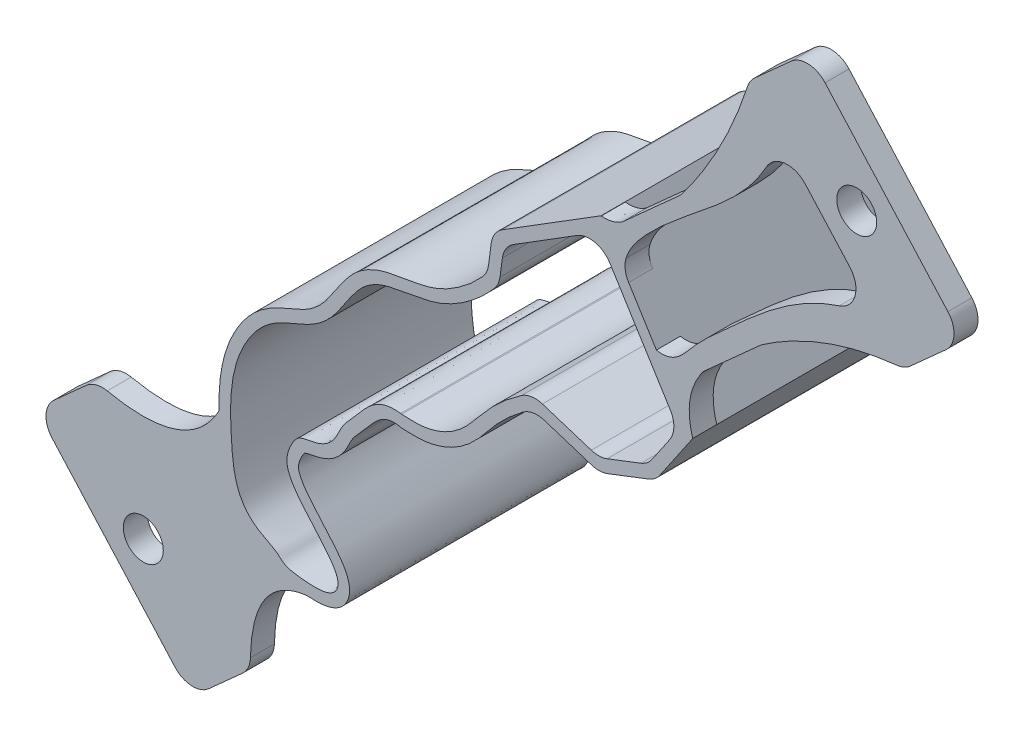
from build123d import *

# Parameters (mm, degrees)
AUFSATZ_LINEAR_AUSTRAGEN1_DEPTH     = 30
AUFSATZ_LINEAR_START                = -3
AUFSATZ_LINEAR_AUSTRAGEN2_OUTLINE_R = 2.5
AUFSATZ_LINEAR_AUSTRAGEN2_DEPTH     = 3
VERRUNDUNG3_R                       = 3
VERRUNDUNG4_R                       = 3
VERRUNDUNG5_R                       = 3


with BuildPart() as part:
    # Skizze1 → Aufsatz-Linear austragen1 (new body)
    with BuildSketch(Plane.XY):
        with BuildLine():
            Line((40.712795696, 109.980558381), (41.357196523, 114.844095725))
            Line((41.357196523, 114.844095725), (54.9236108, 123.298967756))
            Line((54.9236108, 123.298967756), (66.390293439, 104.899899561))
            Line((66.390293439, 104.899899561), (61.744811743, 98.070839034))
            Line((61.744811743, 98.070839034), (54.740060962, 95.368898907))
            Line((54.740060962, 95.368898907), (46.430160156, 98.015797727))
            add(Edge.make_bspline(
                [(46.430160156, 98.015797727), (46.133118112, 97.821539469), (45.560194818, 97.435582063), (44.323214705, 96.52582267), (43.021043899, 95.418325919), (41.744902268, 94.077457141), (40.736662715, 92.859306382), (39.581081755, 91.433941103), (37.778639533, 89.690678695), (35.451956815, 88.348509895), (33.277875943, 87.844682389), (31.822691433, 87.748576032), (30.914882413, 87.763513011), (30.334792, 87.799233053), (30.071333911, 87.812696327), (30.000726266, 87.815038818), (29.939219568, 87.815295899), (29.911740929, 87.815436571)],
                knots=[0.076021596, 0.076021596, 0.076021596, 0.076021596, 0.09538587, 0.114750145, 0.153478693, 0.172842968, 0.192207242, 0.211571516, 0.23093579, 0.269664339, 0.308392887, 0.327757162, 0.347121436, 0.36648571, 0.376167847, 0.381008916, 0.385849984, 0.385849984, 0.385849984, 0.385849984], degree=3))
            Line((29.911740929, 87.815436571), (29.62239267, 87.889670136))
            add(Edge.make_bspline(
                [(40.712795696, 109.980558381), (40.548290105, 109.789990703), (40.039182766, 109.20798272), (39.167861043, 108.296145835), (37.904291205, 107.200078175), (36.515705172, 106.210004839), (35.045545467, 105.391631852), (33.626198045, 104.836349806), (32.054424536, 104.471806717), (30.333212831, 104.194102855), (28.520443777, 103.881275993), (26.631534522, 103.380598721), (24.686505418, 102.296150918), (23.309902097, 100.900500285), (21.9193236, 99.007131286), (20.866202835, 97.283935928), (19.779585209, 96.02734761), (18.843140816, 95.203796027), (17.884364082, 94.594752536), (16.598126478, 94.019608823), (15.023524875, 93.372404681), (13.272103108, 92.514133576), (11.453160876, 91.141228317), (10.021987048, 89.435023934), (8.896885582, 87.567002022), (7.78796415, 84.963327749), (7.122132616, 81.701156546), (7.071348113, 78.520848037), (7.199844736, 76.033432144), (7.323660979, 74.135825703), (7.609070129, 72.026837516), (8.292311289, 69.828834885), (9.438444136, 68.044525364), (10.846814268, 66.847818704), (11.860138531, 66.229023741), (12.747914579, 65.759124634), (13.31528287, 65.457503), (13.515237066, 65.315512768), (13.619103725, 65.232515949), (13.79443678, 65.064182205), (14.29111038, 64.633469416), (15.063218315, 64.226663608), (15.815143452, 64.012618452), (16.597545646, 63.876744695), (17.543475142, 63.76618048), (18.628786313, 63.685945228), (19.57974188, 63.694314785), (20.339163549, 63.762013846), (21.039258726, 63.909981585), (21.685275417, 64.167377768), (22.22136524, 64.482950297), (22.782264662, 64.990062879), (23.260590116, 65.760615934), (23.465211305, 66.62565005), (23.444773621, 67.337049868), (23.3241199, 67.912818377), (23.099695556, 68.547400118), (22.759727338, 69.193862767), (22.295741745, 69.894788562), (21.609475819, 70.799600306), (20.64968698, 71.925960664), (19.462804526, 73.260962624), (18.397347107, 74.503600358), (17.434728056, 75.816893869), (17.097216233, 76.650632456), (17.042572198, 77.103401149), (17.064956934, 77.419740639), (17.178589311, 77.850656011), (17.44570662, 78.473394429), (17.692068021, 78.875336912), (17.831149565, 79.035471349), (17.838343484, 79.036180261), (17.846443889, 79.05344298), (18.164589497, 79.156698605), (18.833630416, 79.274875887), (19.815927828, 79.475390957), (21.073139477, 79.96465406), (22.127912101, 80.793652418), (22.820091659, 81.695228191), (23.212038583, 82.400157107), (23.472755456, 82.945270551), (23.693757496, 83.380460628), (23.907052728, 83.717350053), (24.070879516, 83.926143053), (24.358884063, 84.237035133), (24.879871052, 84.825361069), (25.4181521, 85.476659504), (26.039852268, 86.210458902), (26.621551426, 86.827104219), (27.174014236, 87.306073269), (27.693548249, 87.63638678), (28.20218211, 87.84181382), (28.695408527, 87.929853815), (29.176693256, 87.937336678), (29.479804187, 87.909589639), (29.62239267, 87.889670136)],
                knots=[0.118634606, 0.118634606, 0.118634606, 0.118634606, 0.125304784, 0.139411674, 0.153518565, 0.167625455, 0.181732345, 0.195839236, 0.209946126, 0.224053016, 0.238159906, 0.252266797, 0.266373687, 0.280480577, 0.294587468, 0.322801248, 0.336908138, 0.351015029, 0.365121919, 0.379228809, 0.3933357, 0.40744259, 0.42154948, 0.435656371, 0.449763261, 0.463870151, 0.492083932, 0.520297712, 0.534404603, 0.548511493, 0.562618383, 0.576725273, 0.590832164, 0.597885609, 0.604939054, 0.611992499, 0.619045944, 0.626099389, 0.633152835, 0.64020628, 0.647259725, 0.65431317, 0.661366615, 0.66842006, 0.675473505, 0.682526951, 0.686053673, 0.689580396, 0.693107118, 0.69487048, 0.696633841, 0.698397202, 0.700160563, 0.701923925, 0.703687286, 0.705450647, 0.707214009, 0.710740731, 0.714267454, 0.717794176, 0.724847621, 0.731901067, 0.738954512, 0.746007957, 0.760114847, 0.767168292, 0.774221737, 0.781275183, 0.788328628, 0.795382073, 0.798908795, 0.802435518, 0.809488963, 0.816542408, 0.823595853, 0.830649299, 0.837702744, 0.844756189, 0.848282911, 0.851809634, 0.855336357, 0.858863079, 0.865916524, 0.872969969, 0.880023415, 0.88707686, 0.90118375, 0.91529064, 0.929397531, 0.943504421, 0.957611311, 0.971718201, 0.985825092, 0.992878537, 0.999931982, 0.999931982, 0.999931982, 0.999931982], degree=3))
        make_face()
        with BuildLine():
            Line((29.969568489, 89.315160187), (29.823008434, 89.32572491))
            add(Edge.make_bspline(
                [(29.823008434, 89.32572491), (29.634049207, 89.352122371), (29.239945437, 89.388313818), (28.556460135, 89.379725598), (27.800449797, 89.247010781), (27.012740349, 88.926589837), (26.288278433, 88.46044542), (25.604735463, 87.863939706), (24.949071146, 87.166756868), (24.302692789, 86.402531931), (23.765166835, 85.754158788), (23.296875597, 85.223980047), (22.984762685, 84.889259428), (22.709319238, 84.541368159), (22.427389129, 84.090337415), (22.163192754, 83.567764032), (21.915534142, 83.051499081), (21.601072096, 82.489181169), (21.092456284, 81.830373759), (20.347548142, 81.244177346), (19.422079602, 80.878195214), (18.589754696, 80.703614231), (17.883373743, 80.58093453), (17.330462963, 80.421161029), (16.94451163, 80.212863307), (16.560615727, 79.81069567), (16.143377483, 79.119835447), (15.817093326, 78.360073541), (15.630953758, 77.691932102), (15.580450829, 77.061735956), (15.699777384, 76.176400696), (16.191775108, 75.05526682), (17.275142932, 73.583534846), (18.375150692, 72.302199085), (19.560410501, 70.968886768), (20.486914416, 69.88053956), (21.115302704, 69.050966829), (21.514464193, 68.447177632), (21.824728354, 67.84714316), (21.99285266, 67.299990873), (22.006497445, 66.774045467), (21.900863922, 66.32933119), (21.65833539, 65.935114544), (21.257999222, 65.569862139), (20.739478688, 65.334322114), (20.134344256, 65.200542613), (19.517686804, 65.144571694), (18.691600923, 65.136182948), (17.688996134, 65.209097228), (16.790042598, 65.314573906), (16.125545308, 65.431586086), (15.587937169, 65.589583409), (15.118082163, 65.838511811), (14.795684432, 66.114619963), (14.527280266, 66.36691151), (14.179272352, 66.665834154), (12.875267469, 67.308541253), (11.683031042, 68.03919866), (10.565148073, 68.992869254), (9.630705263, 70.431029017), (9.035705286, 72.320526298), (8.769544386, 74.255257244), (8.647167845, 76.121130102), (8.521724902, 78.550590281), (8.574758706, 81.562367998), (9.306077931, 85.133968069), (10.785287491, 88.088838491), (12.473114823, 90.093876489), (14.524437951, 91.63909992), (16.674202511, 92.46498621), (18.538328804, 93.294841852), (20.126542097, 94.298729135), (21.811069814, 96.030633171), (23.14957242, 98.237535094), (24.42462416, 99.965924623), (25.594243304, 101.139863882), (27.138453327, 102.004845134), (28.808821724, 102.459873297), (30.547468534, 102.759813278), (32.310815277, 103.044008627), (34.0344587, 103.439326146), (36.225850312, 104.294923773), (38.348272833, 105.664791899), (40.162939665, 107.238545873), (41.236119333, 108.361866111), (41.868876925, 109.099692894), (42.153366791, 109.433085994)],
                knots=[0.097128026, 0.097128026, 0.097128026, 0.097128026, 0.104181182, 0.111234338, 0.12534065, 0.139446961, 0.153553273, 0.167659585, 0.181765897, 0.195872209, 0.20997852, 0.217031676, 0.224084832, 0.231137988, 0.238191144, 0.241717722, 0.2452443, 0.248770878, 0.252297456, 0.259350612, 0.266403768, 0.273456924, 0.280510079, 0.287563235, 0.294616391, 0.301669547, 0.308722703, 0.315775859, 0.322829015, 0.329882171, 0.336935327, 0.351041639, 0.358094794, 0.36514795, 0.372201106, 0.379254262, 0.38278084, 0.386307418, 0.389833996, 0.393360574, 0.395123863, 0.396887152, 0.398650441, 0.40041373, 0.403940308, 0.407466886, 0.410993464, 0.414520042, 0.421573198, 0.428626354, 0.435679509, 0.442732665, 0.449785821, 0.456838977, 0.463892133, 0.477998445, 0.492104757, 0.499157913, 0.506211069, 0.52031738, 0.534423692, 0.548530004, 0.562636316, 0.576742628, 0.604955251, 0.633167875, 0.661380498, 0.67548681, 0.689593122, 0.717805746, 0.731912058, 0.746018369, 0.774230993, 0.802443617, 0.816549928, 0.83065624, 0.844762552, 0.858868864, 0.872975176, 0.887081488, 0.901187799, 0.915294111, 0.943506735, 0.957613047, 0.971719358, 0.982979979, 0.982979979, 0.982979979, 0.982979979], degree=3))
            Line((42.153366791, 109.433085994), (42.751236016, 113.945431704))
            Line((42.751236016, 113.945431704), (54.443965517, 121.232584344))
            Line((54.443965517, 121.232584344), (64.600506584, 104.935726952))
            Line((64.600506584, 104.935726952), (60.768000914, 99.301776609))
            Line((60.768000914, 99.301776609), (54.692538997, 96.958290759))
            Line((54.692538997, 96.958290759), (46.213277832, 99.659134835))
            add(Edge.make_bspline(
                [(46.213277832, 99.659134835), (46.074046119, 99.571112549), (45.576552498, 99.253877183), (44.282007394, 98.390317292), (42.601050023, 97.078591748), (40.872340915, 95.372577167), (39.587563122, 93.824135605), (38.200409495, 92.119879887), (36.719306109, 90.843262413), (35.256136367, 90.000038874), (33.846954197, 89.506007558), (32.555681945, 89.284767214), (31.429241277, 89.243534202), (30.677712525, 89.281124916), (30.200713072, 89.308789802), (30.054338296, 89.314726221), (29.969568489, 89.315160187)],
                knots=[0.062554732, 0.062554732, 0.062554732, 0.062554732, 0.072144672, 0.096094206, 0.143993275, 0.167942809, 0.191892343, 0.215841877, 0.239791411, 0.263740945, 0.28769048, 0.311640014, 0.335589548, 0.359539082, 0.371513849, 0.383488616, 0.383488616, 0.383488616, 0.383488616], degree=3))
        make_face(mode=Mode.SUBTRACT)
    extrude(amount=AUFSATZ_LINEAR_AUSTRAGEN1_DEPTH)


with BuildPart() as aufsatz_linear_austragen2_tool:
    # Aufsatz-Linear austragen2: read off the stored shape, not the designer's step
    # Aufsatz-Linear austragen2 outline → Aufsatz-Linear austragen2 (new body)
    # profile 1 of 2: a face of its own
    with BuildSketch(Plane.XY.offset(30).offset(AUFSATZ_LINEAR_START)):
        with BuildLine():
            add(Edge.make_bspline(
                [(-8.336422717, 73.752912258), (3.074458112, 70.794354464), (7.109092291, 78.250253901)],
                knots=[0, 0, 0, 1, 1, 1], degree=2))
            Line((-8.336422717, 73.752912258), (-15.775738573, 67.070354395))
            Line((-15.775738573, 67.070354395), (3.603679231, 45.496338413))
            Line((3.603679231, 45.496338413), (11.042995087, 52.178896277))
            add(Edge.make_bspline(
                [(11.042995087, 52.178896277), (10.771750245, 62.875998511), (18.107544533, 63.727763591)],
                knots=[0, 0, 0, 0.999998529, 0.999998529, 0.999998529], degree=2))
            add(Edge.make_bspline(
                [(7.109092291, 78.250253901), (7.111405156, 78.13458678), (7.129682728, 77.391616419), (7.199844736, 76.033432144), (7.323660979, 74.135825703), (7.609070129, 72.026837516), (8.292311289, 69.828834885), (9.438444136, 68.044525364), (10.846814268, 66.847818704), (11.860138531, 66.229023741), (12.747914579, 65.759124634), (13.31528287, 65.457503), (13.515237066, 65.315512768), (13.619103725, 65.232515949), (13.79443678, 65.064182205), (14.29111038, 64.633469416), (15.063218315, 64.226663608), (15.815143452, 64.012618452), (16.597545646, 63.876744695), (17.361457813, 63.787455431), (17.93031095, 63.739839086), (18.107544533, 63.727763591)],
                knots=[0.517700792, 0.517700792, 0.517700792, 0.517700792, 0.520297712, 0.534404603, 0.548511493, 0.562618383, 0.576725273, 0.590832164, 0.597885609, 0.604939054, 0.611992499, 0.619045944, 0.626099389, 0.633152835, 0.64020628, 0.647259725, 0.65431317, 0.661366615, 0.66842006, 0.675473505, 0.678455244, 0.678455244, 0.678455244, 0.678455244], degree=3))
        make_face()
        with Locations((-2.366371743, 59.624625336)):
            Circle(AUFSATZ_LINEAR_AUSTRAGEN2_OUTLINE_R, mode=Mode.SUBTRACT)
    # profile 2 of 2: a face of its own
    with BuildSketch(Plane.XY.offset(30).offset(AUFSATZ_LINEAR_START)):
        with BuildLine():
            add(Edge.make_bspline(
                [(92.8754695, 125.687032775), (82.961430052, 124.874615409), (74.962770381, 119.327938361)],
                knots=[0, 0, 0, 1, 1, 1], degree=2))
            Line((92.8754695, 125.687032775), (100.314785356, 132.369590638))
            Line((100.314785356, 132.369590638), (80.935367552, 153.94360662))
            Line((80.935367552, 153.94360662), (73.496051696, 147.261048757))
            add(Edge.make_bspline(
                [(73.496051696, 147.261048757), (70.641914478, 138.055370509), (64.896553229, 130.534091812)],
                knots=[0, 0, 0, 1, 1, 1], degree=2))
            Line((64.896553229, 130.534091812), (57.59396858, 123.974356292))
            add(Edge.make_bspline(
                [(54.935823061, 123.279372354), (56.422465919, 123.149629825), (57.59396858, 123.974356292)],
                knots=[0.012628124, 0.012628124, 0.012628124, 1, 1, 1], degree=2))
            Line((54.935823061, 123.279372354), (57.795906516, 118.690174924))
            add(Edge.make_bspline(
                [(77.208331183, 143.128376775), (75.373501088, 135.542348033), (67.899196255, 130.885568322), (60.143664865, 123.860869497), (57.800797767, 120.790317985), (57.795906516, 118.690174924)],
                knots=[0, 0, 0, 0, 0.652969132, 0.809270501, 1, 1, 1, 1], degree=3))
            Line((77.208331183, 143.128376775), (89.555353584, 129.383131108))
            add(Edge.make_bspline(
                [(89.555353584, 129.383131108), (81.167671028, 128.746194294), (74.338957371, 122.205315668), (66.177567302, 114.915562269), (64.109435708, 111.771362879), (61.839444043, 112.202045353)],
                knots=[0, 0, 0, 0, 0.682243363, 0.833132614, 1, 1, 1, 1], degree=3))
            Line((61.839444043, 112.202045353), (66.390293439, 104.899899561))
            add(Edge.make_bspline(
                [(67.660185733, 112.76820284), (65.067709299, 109.157877643), (66.390293439, 104.899899561)],
                knots=[0, 0, 0, 1, 1, 1], degree=2))
            Line((67.660185733, 112.76820284), (74.962770381, 119.327938361))
        make_face()
        with Locations((86.905418526, 139.815319698)):
            Circle(AUFSATZ_LINEAR_AUSTRAGEN2_OUTLINE_R, mode=Mode.SUBTRACT)
    extrude(amount=AUFSATZ_LINEAR_AUSTRAGEN2_DEPTH)


with BuildPart() as part_1:
    add(part.part)


with BuildPart() as part_2:
    # Aufsatz-Linear austragen2: joined with aufsatz_linear_austragen2_tool
    add(part_1.part.fuse(aufsatz_linear_austragen2_tool.part, tol=0.00001))

    # Verrundung3
    verrundung3_edges = [part_2.edges().sort_by_distance(p)[0] for p in [
        (64.896553229, 130.534091812, 28.5),
        (67.660185733, 112.76820284, 28.5),
        (74.962770381, 119.327938361, 28.5),
    ]]
    fillet(verrundung3_edges, radius=VERRUNDUNG3_R)

    # Verrundung4
    verrundung4_edges = [part_2.edges().sort_by_distance(p)[0] for p in [
        (46.213277832, 99.659134835, 15),
        (42.153366791, 109.433085994, 15),
        (42.751236016, 113.945431704, 15),
        (54.692538997, 96.958290759, 15),
        (60.768000914, 99.301776609, 15),
        (64.600506584, 104.935726952, 15),
        (54.443965517, 121.232584344, 15),
        (57.795906516, 118.690174924, 28.5),
        (89.555353584, 129.383131108, 28.5),
        (77.208331183, 143.128376775, 28.5),
        (40.712795696, 109.980558381, 15),
        (46.430160156, 98.015797727, 15),
        (61.744811743, 98.070839034, 15),
        (54.740060962, 95.368898907, 15),
        (41.357196523, 114.844095725, 15),
    ]]
    fillet(verrundung4_edges, radius=VERRUNDUNG4_R)

    # Verrundung5
    verrundung5_edges = [part_2.edges().sort_by_distance(p)[0] for p in [
        (3.603679231, 45.496338413, 28.5),
        (11.042995087, 52.178896277, 28.5),
        (-8.336422717, 73.752912258, 28.5),
        (-15.775738573, 67.070354395, 28.5),
        (73.496051696, 147.261048757, 28.5),
        (80.935367552, 153.94360662, 28.5),
        (100.314785356, 132.369590638, 28.5),
        (92.8754695, 125.687032775, 28.5),
    ]]
    fillet(verrundung5_edges, radius=VERRUNDUNG5_R)


solid = part_2.part
